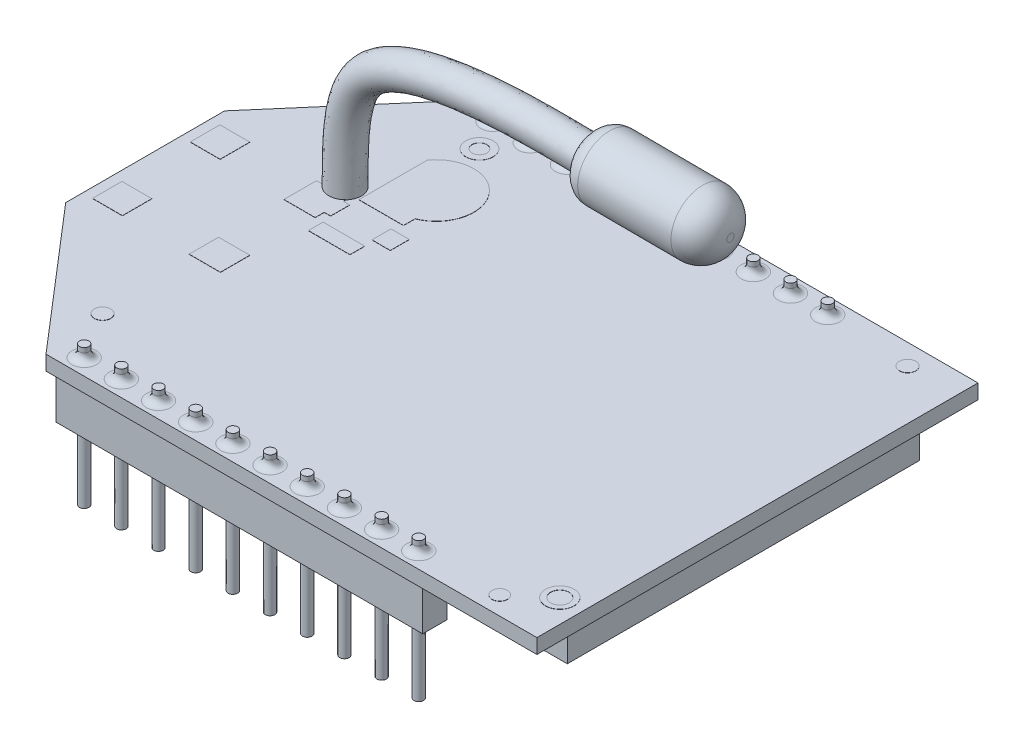
from build123d import *

# Parameters (mm, degrees)
BOSS_EXTRUDE1_DEPTH      = 0.79
BOSS_EXTRUDE2_DEPTH      = 0.65
BOSS_EXTRUDE2_DEPTH_BACK = 6.85
SKETCH4_R                = 0.255
FILLET1_R                = 0.4
SKETCH5_W                = 25.30171518
SKETCH5_H                = 18.96
BOSS_EXTRUDE3_DEPTH      = 2
SKETCH7_W                = 19.725247878
SKETCH7_H                = 1.30520402
BOSS_EXTRUDE4_DEPTH      = 2.32
SKETCH9_R                = 0.439153911
SKETCH9_R_2              = 0.415562845
SKETCH9_R_3              = 0.769867588
SKETCH9_R_4              = 0.498233418
SKETCH9_R_5              = 0.739333414
SKETCH9_R_6              = 0.396542778
SKETCH9_R_7              = 0.442157502
SKETCH9_W                = 1.607111306
SKETCH9_H                = 1.594936221
SKETCH9_W_2              = 2.24021576
SKETCH9_H_2              = 0.791380568
SKETCH9_W_3              = 0.986181938
SKETCH9_H_3              = 1.022707195
SKETCH9_W_4              = 1.68016182
SKETCH9_H_4              = 1.581551397
BOSS_EXTRUDE7_DEPTH      = 0.01
SKETCH10_R               = 0.875
SKETCH14_R               = 1.7
BOSS_EXTRUDE8_DEPTH      = 7.5
FILLET2_R                = 1.5
FILLET3_R                = 1


with BuildPart() as part:
    # Sketch2 → Boss-Extrude1 (new body)
    with BuildSketch(Plane(origin=(0, 0, 0), x_dir=(1, 0, 0), z_dir=(0, 1, 0))):
        Polygon((20.148373537, 0.325), (20.148373537, -11.865), (-6.261626463, -11.865), (-12.791626463, -4.275), (-12.791626463, 4.275), (-6.261626463, 11.865), (20.148373537, 11.865), align=None)
    extrude(amount=BOSS_EXTRUDE1_DEPTH)

    # Sketch4 → Boss-Extrude2 (add, two sides: drawn at the far end of the back side and taken through both)
    with BuildSketch(Plane(origin=(0, 0.79, 0), x_dir=(1, 0, 0), z_dir=(0, 1, 0)).offset(-BOSS_EXTRUDE2_DEPTH_BACK)):
        with Locations(Location((-5.071626463, 11, 0), (0, 0, 270))):
            Circle(SKETCH4_R)
        with Locations(Location((-3.071626463, 11, 0), (0, 0, 270))):
            Circle(SKETCH4_R)
        with Locations(Location((-1.071626463, 11, 0), (0, 0, 270))):
            Circle(SKETCH4_R)
        with Locations(Location((0.928373537, 11, 0), (0, 0, 270))):
            Circle(SKETCH4_R)
        with Locations(Location((2.928373537, 11, 0), (0, 0, 270))):
            Circle(SKETCH4_R)
        with Locations(Location((4.928373537, 11, 0), (0, 0, 270))):
            Circle(SKETCH4_R)
        with Locations(Location((6.928373537, 11, 0), (0, 0, 270))):
            Circle(SKETCH4_R)
        with Locations(Location((8.928373537, 11, 0), (0, 0, 270))):
            Circle(SKETCH4_R)
        with Locations(Location((10.928373537, 11, 0), (0, 0, 270))):
            Circle(SKETCH4_R)
        with Locations(Location((12.928373537, 11, 0), (0, 0, 270))):
            Circle(SKETCH4_R)
        with Locations(Location((12.928373537, -11, 0), (0, 0, 90))):
            Circle(SKETCH4_R)
        with Locations(Location((10.928373537, -11, 0), (0, 0, 90))):
            Circle(SKETCH4_R)
        with Locations(Location((8.928373537, -11, 0), (0, 0, 90))):
            Circle(SKETCH4_R)
        with Locations(Location((6.928373537, -11, 0), (0, 0, 90))):
            Circle(SKETCH4_R)
        with Locations(Location((4.928373537, -11, 0), (0, 0, 90))):
            Circle(SKETCH4_R)
        with Locations(Location((2.928373537, -11, 0), (0, 0, 90))):
            Circle(SKETCH4_R)
        with Locations(Location((0.928373537, -11, 0), (0, 0, 90))):
            Circle(SKETCH4_R)
        with Locations(Location((-1.071626463, -11, 0), (0, 0, 90))):
            Circle(SKETCH4_R)
        with Locations(Location((-3.071626463, -11, 0), (0, 0, 90))):
            Circle(SKETCH4_R)
        with Locations(Location((-5.071626463, -11, 0), (0, 0, 90))):
            Circle(SKETCH4_R)
    extrude(amount=BOSS_EXTRUDE2_DEPTH + BOSS_EXTRUDE2_DEPTH_BACK)

    # Fillet1
    fillet1_edges = [part.edges().sort_by_distance(p)[0] for p in [
        (4.928373537, 0.79, 11.255),
        (2.928373537, 0.79, 11.255),
        (0.928373537, 0.79, 11.255),
        (-1.071626463, 0.79, 11.255),
        (-3.071626463, 0.79, 11.255),
        (-5.071626463, 0.79, 11.255),
        (-5.071626463, 0.79, -11.255),
        (12.928373537, 0.79, 11.255),
        (-3.071626463, 0.79, -11.255),
        (-1.071626463, 0.79, -11.255),
        (0.928373537, 0.79, -11.255),
        (2.928373537, 0.79, -11.255),
        (4.928373537, 0.79, -11.255),
        (6.928373537, 0.79, -11.255),
        (8.928373537, 0.79, -11.255),
        (10.928373537, 0.79, -11.255),
        (12.928373537, 0.79, -11.255),
        (10.928373537, 0.79, 11.255),
        (8.928373537, 0.79, 11.255),
        (6.928373537, 0.79, 11.255),
    ]]
    fillet(fillet1_edges, radius=FILLET1_R)

    # Sketch5 → Boss-Extrude3 (add)
    with BuildSketch(Plane.XZ):
        with Locations((6.747515947, 0)):
            Rectangle(SKETCH5_W, SKETCH5_H)
    extrude(amount=BOSS_EXTRUDE3_DEPTH)

    # Sketch7 → Boss-Extrude4 (add)
    with BuildSketch(Plane.XZ):
        with Locations((3.928373537, 11)):
            Rectangle(SKETCH7_W, SKETCH7_H)
        with Locations((3.928373537, -11)):
            Rectangle(SKETCH7_W, SKETCH7_H)
    extrude(amount=BOSS_EXTRUDE4_DEPTH)

    # Sketch9 → Boss-Extrude7 (add)
    # profile 1 of 12: a face of its own
    with BuildSketch(Plane(origin=(0, 0.79, 0), x_dir=(1, 0, 0), z_dir=(0, 1, 0))):
        with Locations(Location((-6.619304766, -8.467083403, 0), (0, 0, 90))):
            Circle(SKETCH9_R)
    # profile 2 of 12: a face of its own
    with BuildSketch(Plane(origin=(0, 0.79, 0), x_dir=(1, 0, 0), z_dir=(0, 1, 0))):
        with Locations(Location((17.166711075, -10.883808565, 0), (0, 0, 90))):
            Circle(SKETCH9_R_2)
    # profile 3 of 12: a face of its own
    with BuildSketch(Plane(origin=(0, 0.79, 0), x_dir=(1, 0, 0), z_dir=(0, 1, 0))):
        with Locations(Location((18.908964666, -9.390448344, 0), (0, 0, 90))):
            Circle(SKETCH9_R_3)
        with Locations(Location((18.908964666, -9.390448344, 0), (0, 0, 270))):
            Circle(SKETCH9_R_4, mode=Mode.SUBTRACT)
    # profile 4 of 12: a face of its own
    with BuildSketch(Plane(origin=(0, 0.79, 0), x_dir=(1, 0, 0), z_dir=(0, 1, 0))):
        with Locations(Location((-4.161172147, 9.353088155, 0), (0, 0, 90))):
            Circle(SKETCH9_R_5)
        with Locations(Location((-4.161172147, 9.353088155, 0), (0, 0, 270))):
            Circle(SKETCH9_R_6, mode=Mode.SUBTRACT)
    # profile 5 of 12: a face of its own
    with BuildSketch(Plane(origin=(0, 0.79, 0), x_dir=(1, 0, 0), z_dir=(0, 1, 0))):
        with Locations(Location((17.477421182, 10.750824013, 0), (0, 0, 90))):
            Circle(SKETCH9_R_7)
    # profile 6 of 12: a face of its own
    with BuildSketch(Plane(origin=(0, 0.79, 0), x_dir=(1, 0, 0), z_dir=(0, 1, 0))):
        with BuildLine():
            Line((-5.035394812, 7.418905529), (-5.035394812, 3.739759643))
            Line((-5.035394812, 3.739759643), (-2.630875794, 3.739759643))
            Line((-2.630875794, 3.739759643), (-2.630875794, 4.365847194))
            ThreePointArc((-2.630875794, 4.365847194), (-1.790303987, 7.501263651), (-5.035394812, 7.418905529))
        make_face()
    # profile 7 of 12: a face of its own
    with BuildSketch(Plane(origin=(0, 0.79, 0), x_dir=(1, 0, 0), z_dir=(0, 1, 0))):
        with Locations((-11.453740174, 2.688771734)):
            Rectangle(SKETCH9_W, SKETCH9_H)
    # profile 8 of 12: a face of its own
    with BuildSketch(Plane(origin=(0, 0.79, 0), x_dir=(1, 0, 0), z_dir=(0, 1, 0))):
        Polygon((-7.058534253, 3.486239845), (-5.378372433, 3.486239845), (-5.378372433, 3.242738132), (-5.035394812, 3.242738132), (-5.035394812, 2.220030937), (-5.378372433, 2.220030937), (-5.378372433, 1.733027511), (-7.058534253, 1.733027511), align=None)
    # profile 9 of 12: a face of its own
    with BuildSketch(Plane(origin=(0, 0.79, 0), x_dir=(1, 0, 0), z_dir=(0, 1, 0))):
        with Locations((-3.832136555, 1.337337227)):
            Rectangle(SKETCH9_W_2, SKETCH9_H_2)
    # profile 10 of 12: a face of its own
    with BuildSketch(Plane(origin=(0, 0.79, 0), x_dir=(1, 0, 0), z_dir=(0, 1, 0))):
        with Locations((-2.316338392, 2.731384535)):
            Rectangle(SKETCH9_W_3, SKETCH9_H_3)
    # profile 11 of 12: a face of its own
    with BuildSketch(Plane(origin=(0, 0.79, 0), x_dir=(1, 0, 0), z_dir=(0, 1, 0))):
        with Locations((-6.218453343, -2.574104193)):
            Rectangle(SKETCH9_W_4, SKETCH9_H_4)
    # profile 12 of 12: a face of its own
    with BuildSketch(Plane(origin=(0, 0.79, 0), x_dir=(1, 0, 0), z_dir=(0, 1, 0))):
        with Locations((-11.453740174, -2.574104193)):
            Rectangle(SKETCH9_W, SKETCH9_H_4)
    extrude(amount=BOSS_EXTRUDE7_DEPTH)

    # Sweep2: sweep along a path in Sketch13
    with BuildLine() as sweep2_path:  # in the path sketch's own coordinates; laid on its plane below (add() does not lay a ready-made edge on the line's plane)
        add(Edge.make_bspline(
            [(-6.011626463, 0.79), (-5.988917417, 3.31387158), (-6.046398582, 9.210023503), (4.705402871, 8.822783648), (7.208373537, 8.79)],
            knots=[0, 0, 0, 0, 0.234577662, 0.651135621, 0.651135621, 0.651135621, 0.651135621], degree=3))
    # Sketch10 → Sweep2 (sweep)
    with BuildSketch(Plane(origin=(0, 0.79, 0), x_dir=(1, 0, 0), z_dir=(0, 1, 0))):
        with Locations((-6.021626463, 3.985)):
            Circle(SKETCH10_R)
    sweep(path=Plane.XY.offset(-3.99) * sweep2_path.line)

    # Sketch14 → Boss-Extrude8 (add)
    with BuildSketch(Plane(origin=(7.172216543, -0.029404004, 0), x_dir=(0, 0, -1), z_dir=(0.9999915962972856, -0.00409967496355922, 0))):
        with Locations(Location((3.985, 8.82947812, 0), (0, 0, 90))):
            Circle(SKETCH14_R)
    extrude(amount=BOSS_EXTRUDE8_DEPTH)

    # Fillet2
    fillet2_edges = [part.edges().sort_by_distance(p)[0] for p in [
        (14.701382058, 7.06926664, -3.985),
    ]]
    fillet(fillet2_edges, radius=FILLET2_R)

    # Fillet3
    # the kernel refuses this fillet: 1 mm, written as the material it takes off along each edge
    with BuildSketch(Plane(origin=(7.208414534, 8.799999916, -3.985), x_dir=(0.004099674963559313, 0.9999915962972855, 0), z_dir=(0, 0, -1))) as fillet3_piece_1:
        with BuildLine():
            CenterArc((0.7, 0.984568433), FILLET3_R, 280.078658108, 79.921341892)
            Line((0.875, 0), (0.8785, -0.019691369))
            ThreePointArc((0.8785, -0.019691369), (1.2875, -0.02), (1.7, -0.02))
            Line((1.7, -0.02), (1.72, 0))
            Line((1.72, 0), (1.72, 0.984568433))
            Line((1.72, 0.984568433), (1.7, 0.984568433))
        make_face()
    revolve(axis=Axis((7.208414534, 8.799999916, -3.985), (0.9999915962972856, -0.00409967496355922, 0)), mode=Mode.SUBTRACT)


solid = part.part
